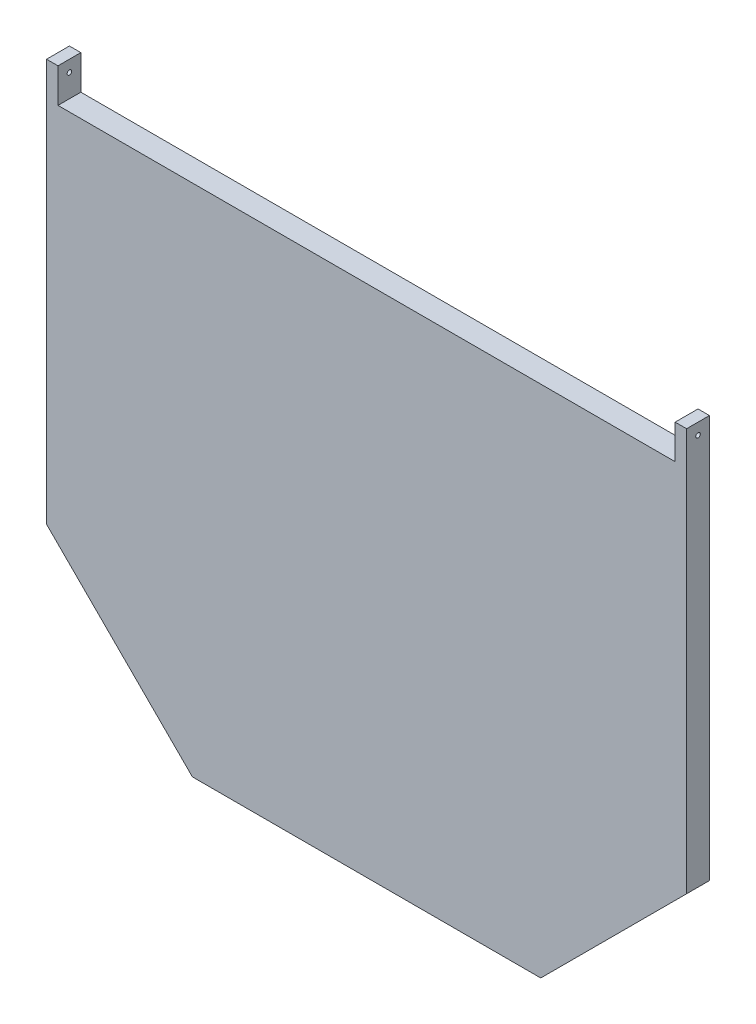
from build123d import *

# Parameters (mm, degrees)
BOSS_EXTRUDE1_DEPTH = 12.7
SKETCH2_W           = 342.9
SKETCH2_H           = 19.05
CUT_EXTRUDE1_DEPTH  = 469.525015341
SKETCH3_R           = 1.27
CUT_EXTRUDE2_DEPTH  = 469.525015341


with BuildPart() as part:
    # Sketch1 → Boss-Extrude1 (new body)
    with BuildSketch(Plane.XY):
        Polygon((355.6, 0), (355.6, -223.774), (274.574, -304.8), (81.026, -304.8), (0, -223.774), (0, 0), align=None)
    extrude(amount=BOSS_EXTRUDE1_DEPTH)

    # Sketch2 → Cut-Extrude1 (cut, through all)
    with BuildSketch(Plane.XY.offset(12.7)):
        with Locations((177.8, -9.525)):
            Rectangle(SKETCH2_W, SKETCH2_H)
    extrude(amount=-CUT_EXTRUDE1_DEPTH, mode=Mode.SUBTRACT)

    # Sketch3 → Cut-Extrude2 (cut, through all)
    with BuildSketch(Plane.ZY):
        with Locations((6.35, -6.35)):
            Circle(SKETCH3_R)
    extrude(amount=-CUT_EXTRUDE2_DEPTH, mode=Mode.SUBTRACT)


solid = part.part
